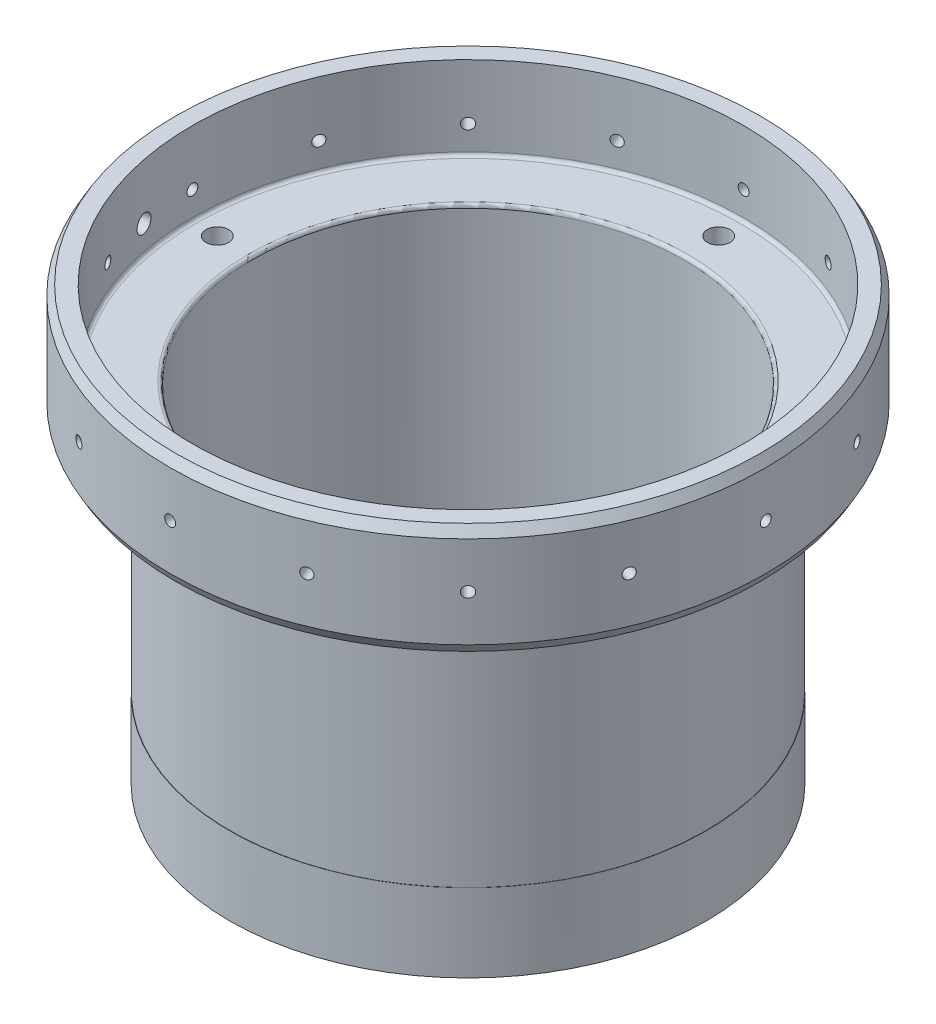
from build123d import *
from OCP.BRepFilletAPI import BRepFilletAPI_MakeChamfer

# Parameters (mm, degrees)
CIRPATTERN1_COUNT                = 16
TAP_DRILL_FOR_10_32_TAP1_D       = 4.0386
TAP_DRILL_FOR_10_32_TAP1_DEPTH   = 10.16
TAP_DRILL_FOR_10_32_TAP1_TIP     = 1.213317848
CIRPATTERN2_COUNT                = 16
F_13_64_0_20313_DIAMETER_HOLE1_D = 5.159502
CIRPATTERN3_COUNT                = 4
CHAMFER2_SIZE                    = 1.27
CHAMFER2_SIZE2                   = 2.199704526
CHAMFER4_SIZE                    = 0.762
CHAMFER4_SIZE2                   = 1.319822715
CHAMFER5_SIZE                    = 0.762
CHAMFER5_SIZE2                   = 1.319822715
FILLET1_R                        = 0.762


with BuildPart() as part:
    # Sketch1 → Revolve6 (revolve)
    with BuildSketch(Plane.XY):
        Polygon((-63.119, 0), (-68.199, 0), (-68.199, -25.4), (-54.60238, -25.4), (-54.60238, -33.909), (-54.48808, -33.909), (-54.48808, -81.026), (-54.55158, -81.026), (-54.55158, -99.669582627), (-49.4665, -99.669582627), (-49.4665, -19.05), (-63.119, -19.05), align=None)
    revolve(axis=Axis((0, 0, 0), (0, 1, 0)))

    # Sketch4 → Tap Drill for M3x0.5 Tap1 (revolve, cut)
    with BuildSketch(Plane(origin=(-68.199, -12.7, 0), x_dir=(0, 0, 1), z_dir=(0, 1, 0))):
        Polygon((0, 0), (0, 10.911075774), (1.25, 10.16), (1.25, 0), align=None)
    tap_drill_for_m3x0_5_tap1 = revolve(axis=Axis((-74.549, -12.7, 0), (1, 0, 0)), mode=Mode.SUBTRACT)

    # CirPattern1: Tap Drill for M3x0.5 Tap1 ×16 about axis
    cirpattern1_axis = Axis((0, 0, 0), (0, -1, 0))
    for i in range(1, CIRPATTERN1_COUNT):
        add(tap_drill_for_m3x0_5_tap1.rotate(cirpattern1_axis, i * 360 / CIRPATTERN1_COUNT), mode=Mode.SUBTRACT)

    # Tap Drill for #10-32 Tap1
    with Locations(Plane(origin=(-66.888575338, 0, 13.304964871), x_dir=(0.19509032201612886, 0, 0.9807852804032304), z_dir=(-0.9807852804032304, 0, 0.19509032201612886))):
        with Locations((0, -12.7)):
            Hole(TAP_DRILL_FOR_10_32_TAP1_D / 2, depth=TAP_DRILL_FOR_10_32_TAP1_DEPTH)
            with Locations((0, 0, -(TAP_DRILL_FOR_10_32_TAP1_DEPTH + TAP_DRILL_FOR_10_32_TAP1_TIP / 2))):  # 118° drill point
                Cone(0, TAP_DRILL_FOR_10_32_TAP1_D / 2, TAP_DRILL_FOR_10_32_TAP1_TIP, mode=Mode.SUBTRACT)

    # Sketch10 → Tap Drill for #4-40 Tap1 (revolve, cut)
    with BuildSketch(Plane(origin=(52.00904, -99.669582627, 0), x_dir=(0, 0, -1), z_dir=(1, 0, 0))):
        Polygon((0, 0), (0, 18.459152758), (1.1303, 17.78), (1.1303, 0), align=None)
    tap_drill_for_4_40_tap1 = revolve(axis=Axis((52.00904, -106.019582627, 0), (0, 1, 0)), mode=Mode.SUBTRACT)

    # CirPattern2: Tap Drill for #4-40 Tap1 ×16 about axis
    cirpattern2_axis = Axis((0, 0, 0), (0, 1, 0))
    for i in range(1, CIRPATTERN2_COUNT):
        add(tap_drill_for_4_40_tap1.rotate(cirpattern2_axis, i * 360 / CIRPATTERN2_COUNT), mode=Mode.SUBTRACT)

    # 13/64 (0.20313) Diameter Hole1 (through all)
    with Locations(Plane(origin=(0, -25.4, 57.39638), x_dir=(0, 0, -1), z_dir=(0, -1, 0))):
        with Locations((0, 0)):
            f_13_64_0_20313_diameter_hole1 = Hole(F_13_64_0_20313_DIAMETER_HOLE1_D / 2)

    # CirPattern3: 13/64 (0.20313) Diameter Hole1 ×4 about axis
    cirpattern3_axis = Axis((0, 0, 0), (0, -1, 0))
    for i in range(1, CIRPATTERN3_COUNT):
        add(f_13_64_0_20313_diameter_hole1.rotate(cirpattern3_axis, i * 360 / CIRPATTERN3_COUNT), mode=Mode.SUBTRACT)

    # Chamfer2: one chamfer whose edges measure the first distance from different faces: ONE call of the kernel's chamfer builder (chamfer() names one face for all edges)
    chamfer2_edges_1 = [part.edges().sort_by_distance(p)[0] for p in [
        (68.199, -25.4, 0),
    ]]
    chamfer2_side_1 = [part.faces().sort_by_distance(p)[0] for p in [
        (66.270040985, -25.4, 0),
    ]]
    chamfer2_edges_2 = [part.edges().sort_by_distance(p)[0] for p in [
        (68.199, 0, 0),
    ]]
    chamfer2_side_2 = [part.faces().sort_by_distance(p)[0] for p in [
        (65.047959015, 0, 0),
    ]]
    chamfer2 = BRepFilletAPI_MakeChamfer(part.part.solid().wrapped)
    for e in chamfer2_edges_1:
        chamfer2.Add(CHAMFER2_SIZE, CHAMFER2_SIZE2, e.wrapped, chamfer2_side_1[0].wrapped)  # the first distance lies on this face
    for e in chamfer2_edges_2:
        chamfer2.Add(CHAMFER2_SIZE, CHAMFER2_SIZE2, e.wrapped, chamfer2_side_2[0].wrapped)  # the first distance lies on this face
    add(Compound.cast(chamfer2.Shape()), mode=Mode.REPLACE)

    # Chamfer4
    chamfer4_edges = [part.edges().sort_by_distance(p)[0] for p in [
        (54.55158, -99.669582627, 0),
    ]]
    chamfer4_side = [part.faces().sort_by_distance(p)[0] for p in [
        (54.55158, -90.347791313, 0),
    ]]
    chamfer(chamfer4_edges, length=CHAMFER4_SIZE, length2=CHAMFER4_SIZE2, reference=chamfer4_side[0])

    # Chamfer5
    chamfer5_edges = [part.edges().sort_by_distance(p)[0] for p in [
        (49.4665, -99.669582627, 0),
    ]]
    chamfer5_side = [part.faces().sort_by_distance(p)[0] for p in [
        (38.639822807, -99.669582627, -34.912066927),
    ]]
    chamfer(chamfer5_edges, length=CHAMFER5_SIZE, length2=CHAMFER5_SIZE2, reference=chamfer5_side[0])

    # Fillet1
    fillet1_edges = [part.edges().sort_by_distance(p)[0] for p in [
        (63.119, -19.05, 0),
        (49.4665, -19.05, 0),
    ]]
    fillet(fillet1_edges, radius=FILLET1_R)


solid = part.part
